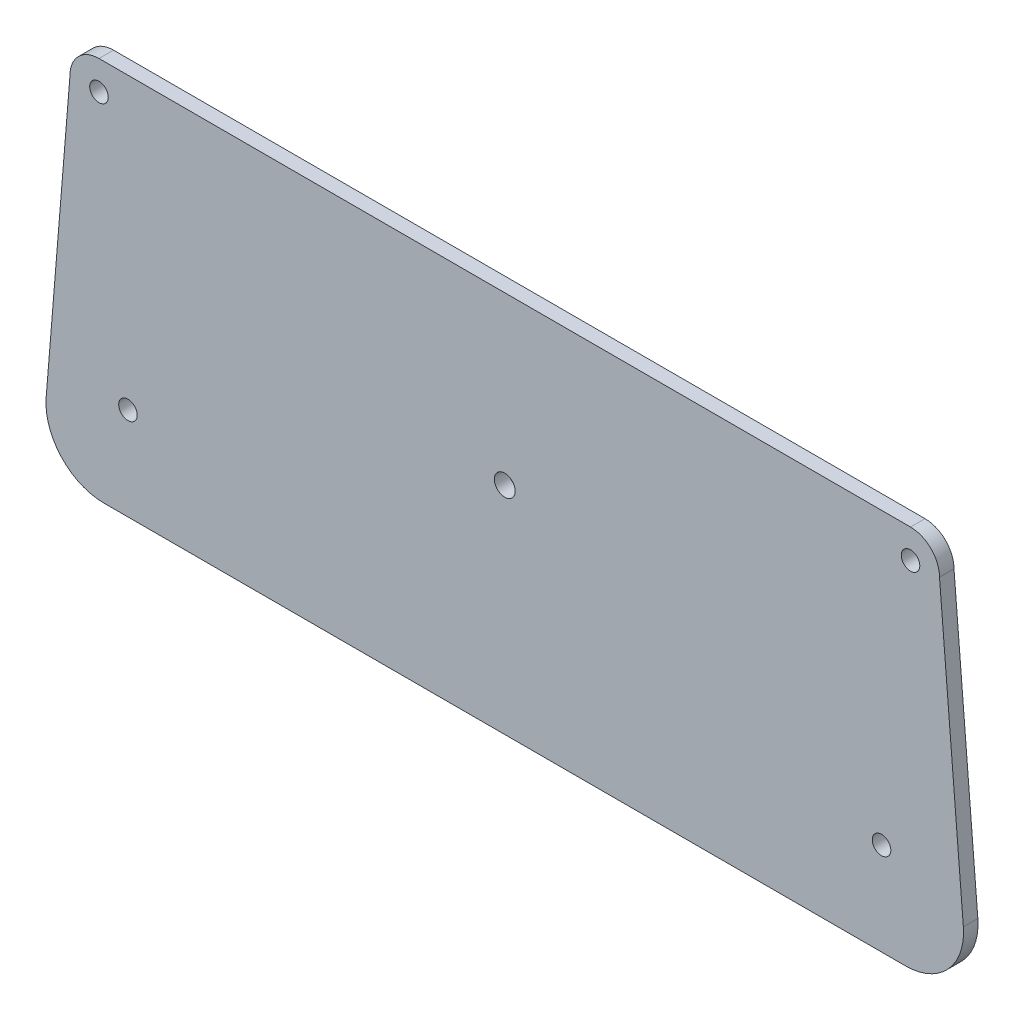
from build123d import *

# Parameters (mm, degrees)
SKETCH1_R           = 2.286
SKETCH1_R_2         = 2.032
BOSS_EXTRUDE1_DEPTH = 3.175
FILLET1_R           = 12.7


with BuildPart() as part:
    # Sketch1 → Boss-Extrude1 (new body)
    with BuildSketch(Plane.XY):
        with BuildLine():
            Line((-87.251790909, 103.545695632), (115.948209091, 103.545695632))
            Line((115.948209091, 103.545695632), (109.598209091, 181.015695632))
            ThreePointArc((109.598209091, 181.015695632), (107.738337152, 185.505823692), (103.248209091, 187.365695632))
            Line((103.248209091, 187.365695632), (-74.551790909, 187.365695632))
            ThreePointArc((-74.551790909, 187.365695632), (-79.041918969, 185.505823692), (-80.901790909, 181.015695632))
            Line((-80.901790909, 181.015695632), (-87.251790909, 103.545695632))
        make_face()
        with Locations((14.348209091, 150.853195632)):
            Circle(SKETCH1_R, mode=Mode.SUBTRACT)
        with Locations((-74.551790909, 181.015695632)):
            Circle(SKETCH1_R_2, mode=Mode.SUBTRACT)
        with Locations((103.248209091, 181.015695632)):
            Circle(SKETCH1_R_2, mode=Mode.SUBTRACT)
        with Locations((96.898209091, 123.865695632)):
            Circle(SKETCH1_R_2, mode=Mode.SUBTRACT)
        with Locations((-68.201790909, 123.865695632)):
            Circle(SKETCH1_R_2, mode=Mode.SUBTRACT)
    extrude(amount=BOSS_EXTRUDE1_DEPTH)

    # Fillet1
    fillet1_edges = [part.edges().sort_by_distance(p)[0] for p in [
        (-87.251790909, 103.545695632, 1.5875),
        (115.948209091, 103.545695632, 1.5875),
    ]]
    fillet(fillet1_edges, radius=FILLET1_R)


solid = part.part
